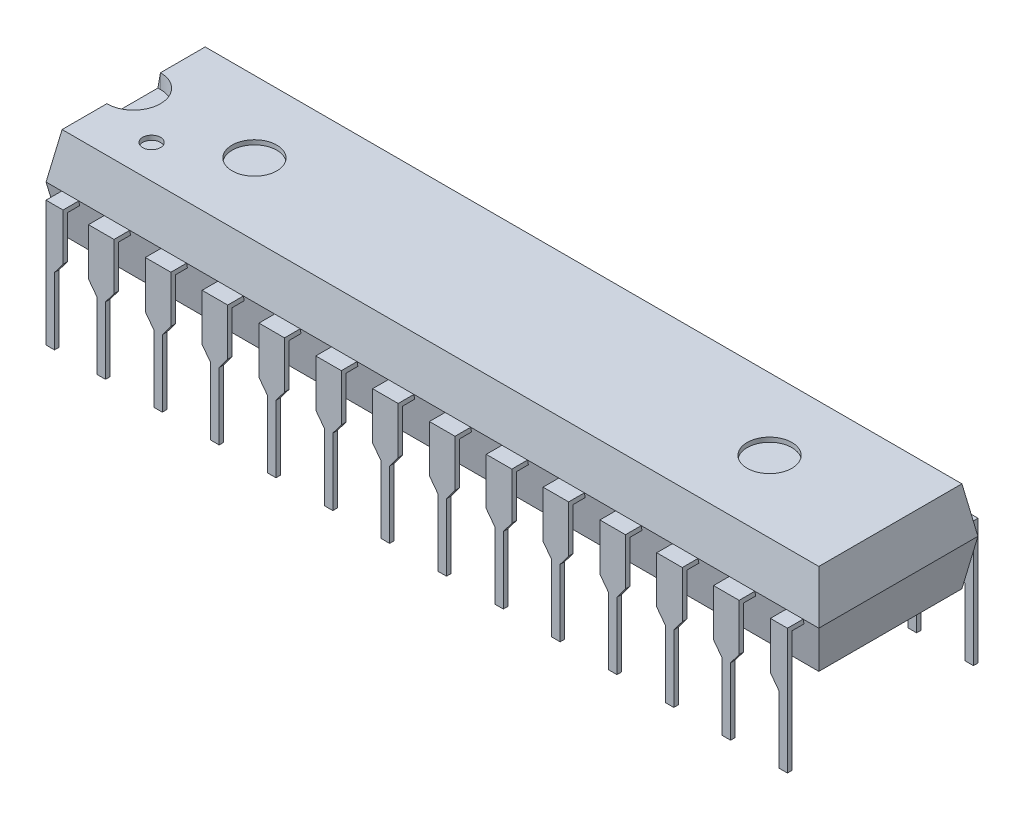
from build123d import *

# Parameters (mm, degrees)
SKETCH1_W                = 34.54
SKETCH1_H                = 7.112
BOSS_EXTRUDE1_DEPTH      = 2.0322
BOSS_EXTRUDE1_TAPER      = 10
BOSS_EXTRUDE2_DEPTH      = 0.203
BOSS_EXTRUDE3_REACH      = 21.689
SKETCH4_W                = 0.762
SKETCH4_H                = 0.203
BOSS_EXTRUDE4_DEPTH      = 0.203
BOSS_EXTRUDE5_START      = -0.203
SKETCH6_W                = 1.143
SKETCH6_H                = 0.203
BOSS_EXTRUDE5_DEPTH      = 8.518
LPATTERN1_COUNT          = 12
LPATTERN1_PITCH          = 2.54
MIRROR7_COPY_1_DEPTH     = 0.203
MIRROR7_COPY_2_DEPTH     = 0.203
MIRROR7_COPY_3_DEPTH     = 0.203
MIRROR7_COPY_4_DEPTH     = 0.203
MIRROR7_COPY_5_DEPTH     = 0.203
MIRROR7_COPY_6_DEPTH     = 0.203
MIRROR7_COPY_7_DEPTH     = 0.203
MIRROR7_COPY_8_DEPTH     = 0.203
MIRROR7_COPY_9_DEPTH     = 0.203
MIRROR7_COPY_10_DEPTH    = 0.203
MIRROR7_COPY_11_DEPTH    = 0.203
MIRROR7_START            = -0.203
MIRROR7_COPY_12_SKETCH_W = 1.143
MIRROR7_COPY_12_SKETCH_H = 0.203
MIRROR7_COPY_12_DEPTH    = 8.518
MIRROR7_COPY_13_SKETCH_W = 1.143
MIRROR7_COPY_13_SKETCH_H = 0.203
MIRROR7_COPY_13_DEPTH    = 8.518
MIRROR7_COPY_14_SKETCH_W = 1.143
MIRROR7_COPY_14_SKETCH_H = 0.203
MIRROR7_COPY_14_DEPTH    = 8.518
MIRROR7_COPY_15_SKETCH_W = 1.143
MIRROR7_COPY_15_SKETCH_H = 0.203
MIRROR7_COPY_15_DEPTH    = 8.518
MIRROR7_COPY_16_SKETCH_W = 1.143
MIRROR7_COPY_16_SKETCH_H = 0.203
MIRROR7_COPY_16_DEPTH    = 8.518
MIRROR7_COPY_17_SKETCH_W = 1.143
MIRROR7_COPY_17_SKETCH_H = 0.203
MIRROR7_COPY_17_DEPTH    = 8.518
MIRROR7_COPY_18_SKETCH_W = 1.143
MIRROR7_COPY_18_SKETCH_H = 0.203
MIRROR7_COPY_18_DEPTH    = 8.518
MIRROR7_COPY_19_SKETCH_W = 1.143
MIRROR7_COPY_19_SKETCH_H = 0.203
MIRROR7_COPY_19_DEPTH    = 8.518
MIRROR7_COPY_20_SKETCH_W = 1.143
MIRROR7_COPY_20_SKETCH_H = 0.203
MIRROR7_COPY_20_DEPTH    = 8.518
MIRROR7_COPY_21_SKETCH_W = 1.143
MIRROR7_COPY_21_SKETCH_H = 0.203
MIRROR7_COPY_21_DEPTH    = 8.518
MIRROR7_COPY_22_SKETCH_W = 1.143
MIRROR7_COPY_22_SKETCH_H = 0.203
MIRROR7_COPY_22_DEPTH    = 8.518
CUT_EXTRUDE1_DEPTH       = 0.65
SKETCH8_R                = 1
CUT_EXTRUDE2_DEPTH       = 0.2
SKETCH9_R                = 0.4
CUT_EXTRUDE3_DEPTH       = 0.2


with BuildPart() as part:
    # Sketch1 → Boss-Extrude1 (new body)
    with BuildSketch(Plane(origin=(0, 0, 0), x_dir=(1, 0, 0), z_dir=(0, 1, 0))):
        Rectangle(SKETCH1_W, SKETCH1_H)
    boss_extrude1 = extrude(amount=BOSS_EXTRUDE1_DEPTH, taper=BOSS_EXTRUDE1_TAPER)

    # Mirror1: Boss-Extrude1 across plane
    add(boss_extrude1.mirror(Plane.ZX))



with BuildPart() as body_2:
    # Sketch2 → Boss-Extrude2 (new body)
    with BuildSketch(Plane.XY.offset(4.056)):
        Polygon((16.57, 0), (15.808, 0), (15.808, -2.1), (16.189, -2.608), (16.189, -5.608), (16.57, -5.608), align=None)
    extrude(amount=BOSS_EXTRUDE2_DEPTH)


with BuildPart() as part_1:
    add(part.part)

    add(body_2.part)  # Boss-Extrude3 merges body 2
    # Boss-Extrude3: up to this plane
    boss_extrude3_end = Plane(origin=(-17.27, 0, 3.556), z_dir=(0, -0.17364817766693072, 0.984807753012208))
    # Sketch4 → Boss-Extrude3 (add, up to the surface)
    with BuildSketch(Plane(origin=(0, 0, 4.056), x_dir=(-1, 0, 0), z_dir=(0, 0, -1)), mode=Mode.PRIVATE) as boss_extrude3_sk1:
        with Locations((-16.189, -0.1015)):
            Rectangle(SKETCH4_W, SKETCH4_H)
    boss_extrude3_tool1 = split(extrude(boss_extrude3_sk1.sketch, amount=BOSS_EXTRUDE3_REACH, mode=Mode.PRIVATE), bisect_by=boss_extrude3_end, keep=Keep.BOTH, mode=Mode.PRIVATE)
    add(boss_extrude3_tool1.solids().sort_by_distance((16.189, -0.1015, 4.056))[0])

    # Mirror5: part across plane


with BuildPart() as part_2:
    add(part_1.part)
    add(part_1.part.mirror(Plane(origin=(0, 0, 0), x_dir=(0, 0, 1), z_dir=(1, 0, 0))))

    # Mirror6: part across plane


with BuildPart() as part_3:
    add(part_2.part)
    add(part_2.part.mirror(Plane.XY))



with BuildPart() as body_2_2:
    # Sketch5 → Boss-Extrude4 (new body)
    with BuildSketch(Plane.XY.offset(4.056)):
        Polygon((13.268, 0), (14.411, 0), (14.411, -2.1), (14.03, -2.608), (14.03, -5.608), (13.649, -5.608), (13.649, -2.608), (13.268, -2.1), align=None)
    boss_extrude4 = extrude(amount=BOSS_EXTRUDE4_DEPTH)


with BuildPart() as part_4:
    add(part_3.part)

    add(body_2_2.part)  # Boss-Extrude5 merges body 2 2
    # Sketch6 → Boss-Extrude5 (add)
    with BuildSketch(Plane(origin=(0, 0, 4.056), x_dir=(-1, 0, 0), z_dir=(0, 0, -1)).offset(BOSS_EXTRUDE5_START)):
        with Locations((-13.8395, -0.1015)):
            Rectangle(SKETCH6_W, SKETCH6_H)
    boss_extrude5 = extrude(amount=BOSS_EXTRUDE5_DEPTH)

    # LPattern1: Boss-Extrude4, Boss-Extrude5 ×12
    with Locations(*[(-i * LPATTERN1_PITCH, 0, 0) for i in range(1, LPATTERN1_COUNT)]):
        add(boss_extrude4)
        add(boss_extrude5)

    # Mirror7: Boss-Extrude4, Boss-Extrude5 across plane
    add(boss_extrude4.mirror(Plane.XY))
    add(boss_extrude5.mirror(Plane.XY))

    # Mirror7 copy 1 sketch → Mirror7 copy 1 (add)
    with BuildSketch(Plane(origin=(-2.54, 0, -4.056), x_dir=(1, 0, 0), z_dir=(0, 0, -1))):
        Polygon((13.268, 0), (14.411, 0), (14.411, 2.1), (14.03, 2.608), (14.03, 5.608), (13.649, 5.608), (13.649, 2.608), (13.268, 2.1), align=None)
    extrude(amount=MIRROR7_COPY_1_DEPTH)

    # Mirror7 copy 2 sketch → Mirror7 copy 2 (add)
    with BuildSketch(Plane(origin=(-5.08, 0, -4.056), x_dir=(1, 0, 0), z_dir=(0, 0, -1))):
        Polygon((13.268, 0), (14.411, 0), (14.411, 2.1), (14.03, 2.608), (14.03, 5.608), (13.649, 5.608), (13.649, 2.608), (13.268, 2.1), align=None)
    extrude(amount=MIRROR7_COPY_2_DEPTH)

    # Mirror7 copy 3 sketch → Mirror7 copy 3 (add)
    with BuildSketch(Plane(origin=(-7.62, 0, -4.056), x_dir=(1, 0, 0), z_dir=(0, 0, -1))):
        Polygon((13.268, 0), (14.411, 0), (14.411, 2.1), (14.03, 2.608), (14.03, 5.608), (13.649, 5.608), (13.649, 2.608), (13.268, 2.1), align=None)
    extrude(amount=MIRROR7_COPY_3_DEPTH)

    # Mirror7 copy 4 sketch → Mirror7 copy 4 (add)
    with BuildSketch(Plane(origin=(-10.16, 0, -4.056), x_dir=(1, 0, 0), z_dir=(0, 0, -1))):
        Polygon((13.268, 0), (14.411, 0), (14.411, 2.1), (14.03, 2.608), (14.03, 5.608), (13.649, 5.608), (13.649, 2.608), (13.268, 2.1), align=None)
    extrude(amount=MIRROR7_COPY_4_DEPTH)

    # Mirror7 copy 5 sketch → Mirror7 copy 5 (add)
    with BuildSketch(Plane(origin=(-12.7, 0, -4.056), x_dir=(1, 0, 0), z_dir=(0, 0, -1))):
        Polygon((13.268, 0), (14.411, 0), (14.411, 2.1), (14.03, 2.608), (14.03, 5.608), (13.649, 5.608), (13.649, 2.608), (13.268, 2.1), align=None)
    extrude(amount=MIRROR7_COPY_5_DEPTH)

    # Mirror7 copy 6 sketch → Mirror7 copy 6 (add)
    with BuildSketch(Plane(origin=(-15.24, 0, -4.056), x_dir=(1, 0, 0), z_dir=(0, 0, -1))):
        Polygon((13.268, 0), (14.411, 0), (14.411, 2.1), (14.03, 2.608), (14.03, 5.608), (13.649, 5.608), (13.649, 2.608), (13.268, 2.1), align=None)
    extrude(amount=MIRROR7_COPY_6_DEPTH)

    # Mirror7 copy 7 sketch → Mirror7 copy 7 (add)
    with BuildSketch(Plane(origin=(-17.78, 0, -4.056), x_dir=(1, 0, 0), z_dir=(0, 0, -1))):
        Polygon((13.268, 0), (14.411, 0), (14.411, 2.1), (14.03, 2.608), (14.03, 5.608), (13.649, 5.608), (13.649, 2.608), (13.268, 2.1), align=None)
    extrude(amount=MIRROR7_COPY_7_DEPTH)

    # Mirror7 copy 8 sketch → Mirror7 copy 8 (add)
    with BuildSketch(Plane(origin=(-20.32, 0, -4.056), x_dir=(1, 0, 0), z_dir=(0, 0, -1))):
        Polygon((13.268, 0), (14.411, 0), (14.411, 2.1), (14.03, 2.608), (14.03, 5.608), (13.649, 5.608), (13.649, 2.608), (13.268, 2.1), align=None)
    extrude(amount=MIRROR7_COPY_8_DEPTH)

    # Mirror7 copy 9 sketch → Mirror7 copy 9 (add)
    with BuildSketch(Plane(origin=(-22.86, 0, -4.056), x_dir=(1, 0, 0), z_dir=(0, 0, -1))):
        Polygon((13.268, 0), (14.411, 0), (14.411, 2.1), (14.03, 2.608), (14.03, 5.608), (13.649, 5.608), (13.649, 2.608), (13.268, 2.1), align=None)
    extrude(amount=MIRROR7_COPY_9_DEPTH)

    # Mirror7 copy 10 sketch → Mirror7 copy 10 (add)
    with BuildSketch(Plane(origin=(-25.4, 0, -4.056), x_dir=(1, 0, 0), z_dir=(0, 0, -1))):
        Polygon((13.268, 0), (14.411, 0), (14.411, 2.1), (14.03, 2.608), (14.03, 5.608), (13.649, 5.608), (13.649, 2.608), (13.268, 2.1), align=None)
    extrude(amount=MIRROR7_COPY_10_DEPTH)

    # Mirror7 copy 11 sketch → Mirror7 copy 11 (add)
    with BuildSketch(Plane(origin=(-27.94, 0, -4.056), x_dir=(1, 0, 0), z_dir=(0, 0, -1))):
        Polygon((13.268, 0), (14.411, 0), (14.411, 2.1), (14.03, 2.608), (14.03, 5.608), (13.649, 5.608), (13.649, 2.608), (13.268, 2.1), align=None)
    extrude(amount=MIRROR7_COPY_11_DEPTH)

    # Mirror7 copy 12 sketch → Mirror7 copy 12 (add)
    with BuildSketch(Plane(origin=(-2.54, 0, -4.056), x_dir=(-1, 0, 0), z_dir=(0, 0, 1)).offset(MIRROR7_START)):
        with Locations((-13.8395, 0.1015)):
            Rectangle(MIRROR7_COPY_12_SKETCH_W, MIRROR7_COPY_12_SKETCH_H)
    extrude(amount=MIRROR7_COPY_12_DEPTH)

    # Mirror7 copy 13 sketch → Mirror7 copy 13 (add)
    with BuildSketch(Plane(origin=(-5.08, 0, -4.056), x_dir=(-1, 0, 0), z_dir=(0, 0, 1)).offset(MIRROR7_START)):
        with Locations((-13.8395, 0.1015)):
            Rectangle(MIRROR7_COPY_13_SKETCH_W, MIRROR7_COPY_13_SKETCH_H)
    extrude(amount=MIRROR7_COPY_13_DEPTH)

    # Mirror7 copy 14 sketch → Mirror7 copy 14 (add)
    with BuildSketch(Plane(origin=(-7.62, 0, -4.056), x_dir=(-1, 0, 0), z_dir=(0, 0, 1)).offset(MIRROR7_START)):
        with Locations((-13.8395, 0.1015)):
            Rectangle(MIRROR7_COPY_14_SKETCH_W, MIRROR7_COPY_14_SKETCH_H)
    extrude(amount=MIRROR7_COPY_14_DEPTH)

    # Mirror7 copy 15 sketch → Mirror7 copy 15 (add)
    with BuildSketch(Plane(origin=(-10.16, 0, -4.056), x_dir=(-1, 0, 0), z_dir=(0, 0, 1)).offset(MIRROR7_START)):
        with Locations((-13.8395, 0.1015)):
            Rectangle(MIRROR7_COPY_15_SKETCH_W, MIRROR7_COPY_15_SKETCH_H)
    extrude(amount=MIRROR7_COPY_15_DEPTH)

    # Mirror7 copy 16 sketch → Mirror7 copy 16 (add)
    with BuildSketch(Plane(origin=(-12.7, 0, -4.056), x_dir=(-1, 0, 0), z_dir=(0, 0, 1)).offset(MIRROR7_START)):
        with Locations((-13.8395, 0.1015)):
            Rectangle(MIRROR7_COPY_16_SKETCH_W, MIRROR7_COPY_16_SKETCH_H)
    extrude(amount=MIRROR7_COPY_16_DEPTH)

    # Mirror7 copy 17 sketch → Mirror7 copy 17 (add)
    with BuildSketch(Plane(origin=(-15.24, 0, -4.056), x_dir=(-1, 0, 0), z_dir=(0, 0, 1)).offset(MIRROR7_START)):
        with Locations((-13.8395, 0.1015)):
            Rectangle(MIRROR7_COPY_17_SKETCH_W, MIRROR7_COPY_17_SKETCH_H)
    extrude(amount=MIRROR7_COPY_17_DEPTH)

    # Mirror7 copy 18 sketch → Mirror7 copy 18 (add)
    with BuildSketch(Plane(origin=(-17.78, 0, -4.056), x_dir=(-1, 0, 0), z_dir=(0, 0, 1)).offset(MIRROR7_START)):
        with Locations((-13.8395, 0.1015)):
            Rectangle(MIRROR7_COPY_18_SKETCH_W, MIRROR7_COPY_18_SKETCH_H)
    extrude(amount=MIRROR7_COPY_18_DEPTH)

    # Mirror7 copy 19 sketch → Mirror7 copy 19 (add)
    with BuildSketch(Plane(origin=(-20.32, 0, -4.056), x_dir=(-1, 0, 0), z_dir=(0, 0, 1)).offset(MIRROR7_START)):
        with Locations((-13.8395, 0.1015)):
            Rectangle(MIRROR7_COPY_19_SKETCH_W, MIRROR7_COPY_19_SKETCH_H)
    extrude(amount=MIRROR7_COPY_19_DEPTH)

    # Mirror7 copy 20 sketch → Mirror7 copy 20 (add)
    with BuildSketch(Plane(origin=(-22.86, 0, -4.056), x_dir=(-1, 0, 0), z_dir=(0, 0, 1)).offset(MIRROR7_START)):
        with Locations((-13.8395, 0.1015)):
            Rectangle(MIRROR7_COPY_20_SKETCH_W, MIRROR7_COPY_20_SKETCH_H)
    extrude(amount=MIRROR7_COPY_20_DEPTH)

    # Mirror7 copy 21 sketch → Mirror7 copy 21 (add)
    with BuildSketch(Plane(origin=(-25.4, 0, -4.056), x_dir=(-1, 0, 0), z_dir=(0, 0, 1)).offset(MIRROR7_START)):
        with Locations((-13.8395, 0.1015)):
            Rectangle(MIRROR7_COPY_21_SKETCH_W, MIRROR7_COPY_21_SKETCH_H)
    extrude(amount=MIRROR7_COPY_21_DEPTH)

    # Mirror7 copy 22 sketch → Mirror7 copy 22 (add)
    with BuildSketch(Plane(origin=(-27.94, 0, -4.056), x_dir=(-1, 0, 0), z_dir=(0, 0, 1)).offset(MIRROR7_START)):
        with Locations((-13.8395, 0.1015)):
            Rectangle(MIRROR7_COPY_22_SKETCH_W, MIRROR7_COPY_22_SKETCH_H)
    extrude(amount=MIRROR7_COPY_22_DEPTH)

    # Sketch7 → Cut-Extrude1 (cut)
    with BuildSketch(Plane(origin=(0, 2.0322, 0), x_dir=(1, 0, 0), z_dir=(0, 1, 0))):
        with BuildLine():
            Line((-16.91166831, 1.2), (-18.182625967, 1.2))
            Line((-18.182625967, 1.2), (-18.182625967, -1.2))
            Line((-18.182625967, -1.2), (-16.91166831, -1.2))
            ThreePointArc((-16.91166831, -1.2), (-15.71166831, 0), (-16.91166831, 1.2))
        make_face()
    extrude(amount=-CUT_EXTRUDE1_DEPTH, mode=Mode.SUBTRACT)

    # Sketch8 → Cut-Extrude2 (cut)
    with BuildSketch(Plane(origin=(0, 2.0322, 0), x_dir=(1, 0, 0), z_dir=(0, 1, 0))):
        with Locations(Location((-11.51166831, 0, 0), (0, 0, 270))):
            Circle(SKETCH8_R)
    cut_extrude2 = extrude(amount=-CUT_EXTRUDE2_DEPTH, mode=Mode.SUBTRACT)

    # Mirror8: Cut-Extrude2 across plane
    add(cut_extrude2.mirror(Plane(origin=(0, 0, 0), x_dir=(0, 0, 1), z_dir=(1, 0, 0))), mode=Mode.SUBTRACT)

    # Sketch9 → Cut-Extrude3 (cut)
    with BuildSketch(Plane(origin=(0, 2.0322, 0), x_dir=(1, 0, 0), z_dir=(0, 1, 0))):
        with Locations(Location((-14.41166831, -1.69766831, 0), (0, 0, 270))):
            Circle(SKETCH9_R)
    extrude(amount=-CUT_EXTRUDE3_DEPTH, mode=Mode.SUBTRACT)


solid = part_4.part
